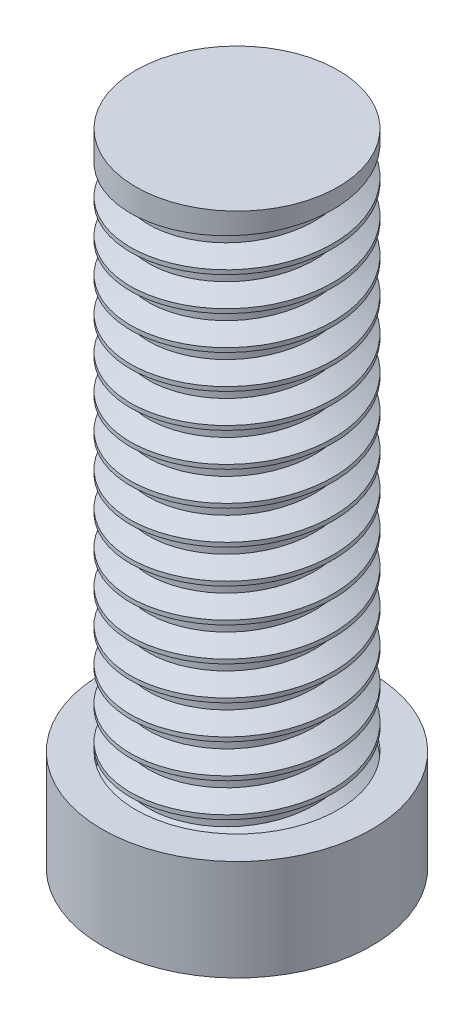
from build123d import *

# Parameters (mm, degrees)
SKETCH1_R           = 2
BOSS_EXTRUDE1_DEPTH = 1.9
SKETCH2_R           = 1.5
BOSS_EXTRUDE2_DEPTH = 8
THREAD1_PITCH       = 0.5
CHAMFER1_SIZE       = 0.7
CHAMFER1_SIZE2      = 0.404145188


with BuildPart() as part:
    # Sketch1 → Boss-Extrude1 (new body)
    with BuildSketch(Plane(origin=(0, 0, 0), x_dir=(1, 0, 0), z_dir=(0, 1, 0))):
        with Locations(Location((0, 0, 0), (0, 0, 90))):
            Circle(SKETCH1_R)
    extrude(amount=BOSS_EXTRUDE1_DEPTH)

    # Sketch2 → Boss-Extrude2 (add)
    with BuildSketch(Plane(origin=(0, 1.9, 0), x_dir=(1, 0, 0), z_dir=(0, 1, 0))):
        with Locations(Location((0, 0, 0), (0, 0, 270))):
            Circle(SKETCH2_R)
    extrude(amount=BOSS_EXTRUDE2_DEPTH)

    # Thread1: the profile of Thread Profile1 profile screwed along a right-hand helix of 16 turns, 6 arcs to a turn; built about Z, then put on its axis
    thread1_z = Axis((0, 0, 0), (0, 0, 1))
    thread1_corners = [(1.5003, 0, -0.000173205), (1.5003, 0, 0.437673204), (1.229367063, 0, 0.281249999), (1.229367063, 0, 0.156249999)]
    with BuildLine(mode=Mode.PRIVATE) as thread1_profile:
        Line(thread1_corners[0], thread1_corners[1])
        Line(thread1_corners[1], thread1_corners[2])
        Line(thread1_corners[2], thread1_corners[3])
        Line(thread1_corners[3], thread1_corners[0])
    thread1_cap = Face(thread1_profile.wire())
    thread1_turn_angles = [0, 30, 60, 90, 120, 150, 180, 210, 240, 270, 300, 330, 360]
    thread1_turn_weights = [1, 0.8660254037844387, 1, 0.8660254037844387, 1, 0.8660254037844387, 1, 0.8660254037844387, 1, 0.8660254037844387, 1, 0.8660254037844387, 1]
    thread1_turn_rails = [Edge.make_bspline([Vector(p[0], p[1], 0).rotate(thread1_z, thread1_turn_angles[k]) / thread1_turn_weights[k] + Vector(0, 0, p[2] + THREAD1_PITCH * thread1_turn_angles[k] / 360) for k in range(13)], [0, 0, 0, 1, 1, 2, 2, 3, 3, 4, 4, 5, 5, 6, 6, 6], 2, thread1_turn_weights) for p in thread1_corners]
    thread1_turn_sides = [Face.make_surface_from_curves(thread1_turn_rails[p[0]], thread1_turn_rails[p[1]]) for p in [(0, 1), (1, 2), (2, 3), (3, 0)]]
    thread1 = Plane(origin=(0, 9.9, 0), x_dir=(-1, 0, 0), z_dir=(0, -1, 0)) * Solid(Shell([*[p.moved(Location((0, 0, THREAD1_PITCH * i))) for i in range(16) for p in thread1_turn_sides], thread1_cap, thread1_cap.rotate(thread1_z, 5760).moved(Location((0, 0, THREAD1_PITCH * 5760 / 360)))]))
    add(thread1, mode=Mode.SUBTRACT)

    # Chamfer1
    chamfer1_edges = [part.edges().sort_by_distance(p)[0] for p in [
        (0, 0, 2),
    ]]
    chamfer1_side = [part.faces().sort_by_distance(p)[0] for p in [
        (0, 0, 0),
    ]]
    chamfer(chamfer1_edges, length=CHAMFER1_SIZE, length2=CHAMFER1_SIZE2, reference=chamfer1_side[0])


solid = part.part
